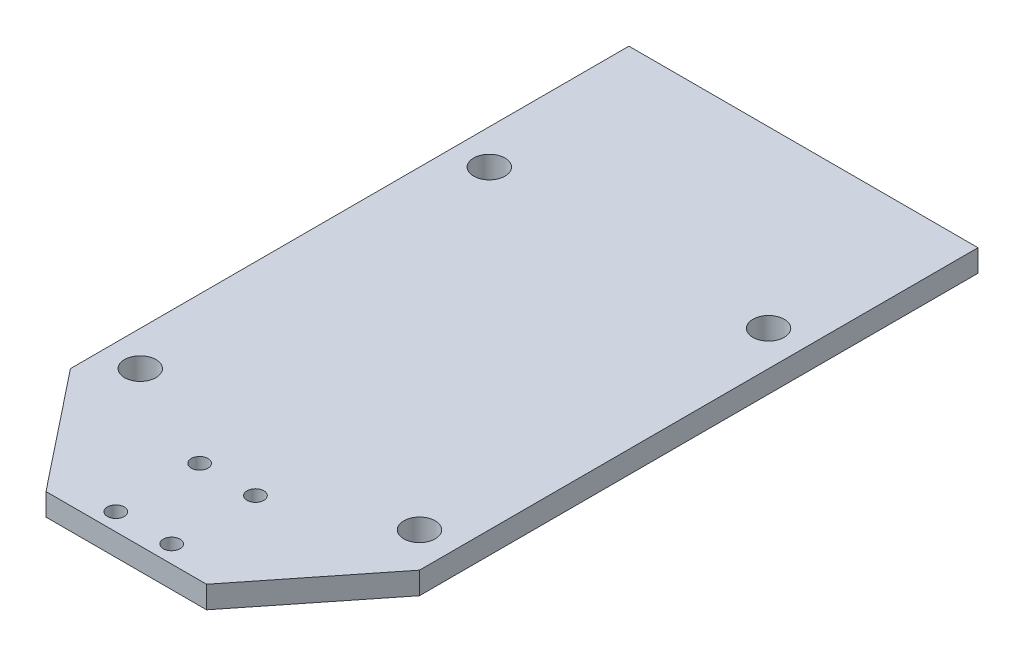
from build123d import *

# Parameters (mm, degrees)
BOSS_EXTRUDE1_DEPTH  = 1.5875
M2_CLEARANCE_HOLE1_D = 2.4
M4_CLEARANCE_HOLE1_D = 4.5


with BuildPart() as part:
    # Sketch1 → Boss-Extrude1 (new, symmetric)
    with BuildSketch(Plane(origin=(0, 0, 0), x_dir=(1, 0, 0), z_dir=(0, 1, 0))):
        Polygon((-25, -40), (-11.5, -57), (11.5, -57), (25, -40), (25, 40), (-25, 40), align=None)
    extrude(amount=BOSS_EXTRUDE1_DEPTH, both=True)

    # M2 Clearance Hole1 (through all)
    with Locations(Plane(origin=(0, 1.5875, 0), x_dir=(1, 0, 0), z_dir=(0, 1, 0))):
        with Locations((-4, -54.5), (4, -54.5), (4, -42.5), (-4, -42.5)):
            Hole(M2_CLEARANCE_HOLE1_D / 2)

    # M4 Clearance Hole1 (through all)
    with Locations(Plane(origin=(0, 1.5875, 0), x_dir=(1, 0, 0), z_dir=(0, 1, 0))):
        with Locations((-20, 15), (20, 15), (20, -35), (-20, -35)):
            Hole(M4_CLEARANCE_HOLE1_D / 2)


solid = part.part
